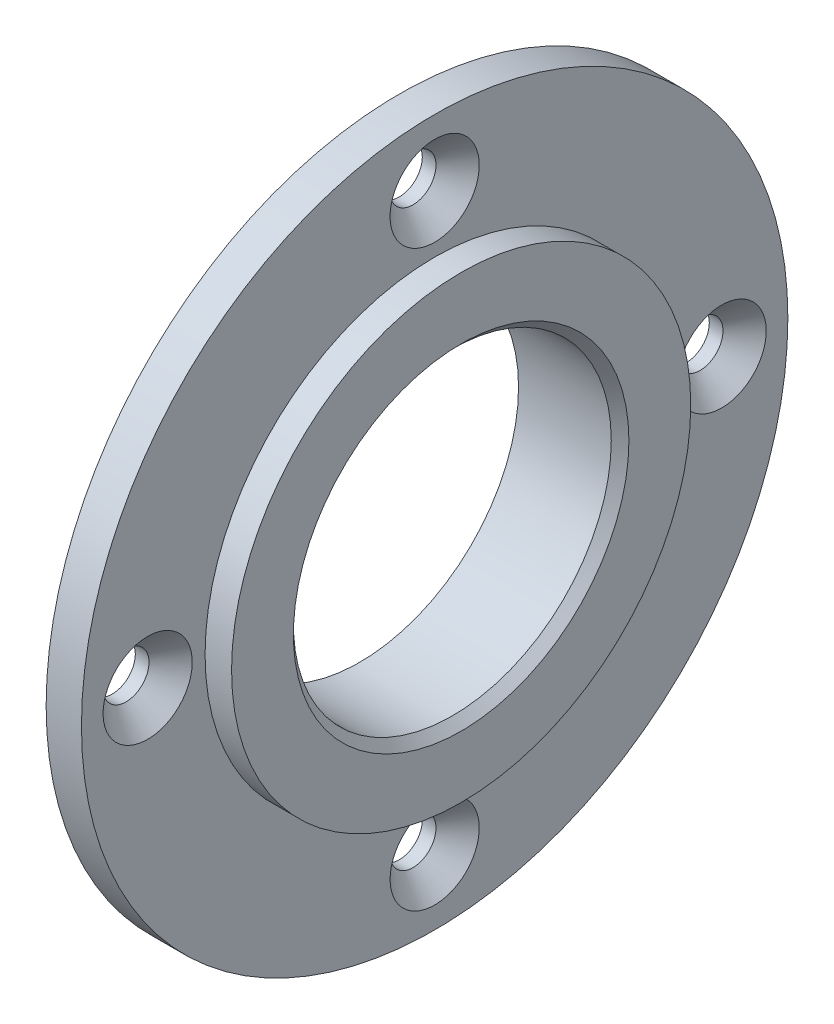
from build123d import *

# Parameters (mm, degrees)
CSK_FOR_M5_COUNTERSUNK_FLAT_HEAD_SCREW1_D           = 5.2
CSK_FOR_M5_COUNTERSUNK_FLAT_HEAD_SCREW1_CSINK_D     = 10.1
CSK_FOR_M5_COUNTERSUNK_FLAT_HEAD_SCREW1_CSINK_ANGLE = 90
CIRPATTERN1_COUNT                                   = 4
CHAMFER1_SIZE                                       = 0.5
CHAMFER2_SIZE                                       = 1


with BuildPart() as part:
    # Sketch2 → Revolve1 (revolve)
    with BuildSketch(Plane.XY):
        Polygon((-174.905599099, 26), (-177.905599099, 26), (-177.905599099, 40), (-181.905599099, 40), (-181.905599099, 21), (-186.405599099, 21), (-186.405599099, 18), (-174.905599099, 18), align=None)
    revolve(axis=Axis((0, 0, 0), (-1, 0, 0)))

    # CSK for M5 Countersunk Flat Head Screw1 (through all)
    with Locations(Plane(origin=(-177.905599099, 0, 0), x_dir=(0, 0, -1), z_dir=(1, 0, 0))):
        with Locations((0, 32.5)):
            csk_for_m5_countersunk_flat_head_screw1 = CounterSinkHole(CSK_FOR_M5_COUNTERSUNK_FLAT_HEAD_SCREW1_D / 2, CSK_FOR_M5_COUNTERSUNK_FLAT_HEAD_SCREW1_CSINK_D / 2, counter_sink_angle=CSK_FOR_M5_COUNTERSUNK_FLAT_HEAD_SCREW1_CSINK_ANGLE)

    # CirPattern1: CSK for M5 Countersunk Flat Head Screw1 ×4 about axis
    cirpattern1_axis = Axis((0, 0, 0), (1, 0, 0))
    for i in range(1, CIRPATTERN1_COUNT):
        add(csk_for_m5_countersunk_flat_head_screw1.rotate(cirpattern1_axis, i * 360 / CIRPATTERN1_COUNT), mode=Mode.SUBTRACT)

    # Chamfer1
    chamfer1_edges = [part.edges().sort_by_distance(p)[0] for p in [
        (-186.405599099, -21, 0),
    ]]
    chamfer(chamfer1_edges, length=CHAMFER1_SIZE)

    # Chamfer2
    chamfer2_edges = [part.edges().sort_by_distance(p)[0] for p in [
        (-174.905599099, -18, 0),
    ]]
    chamfer(chamfer2_edges, length=CHAMFER2_SIZE)


solid = part.part
